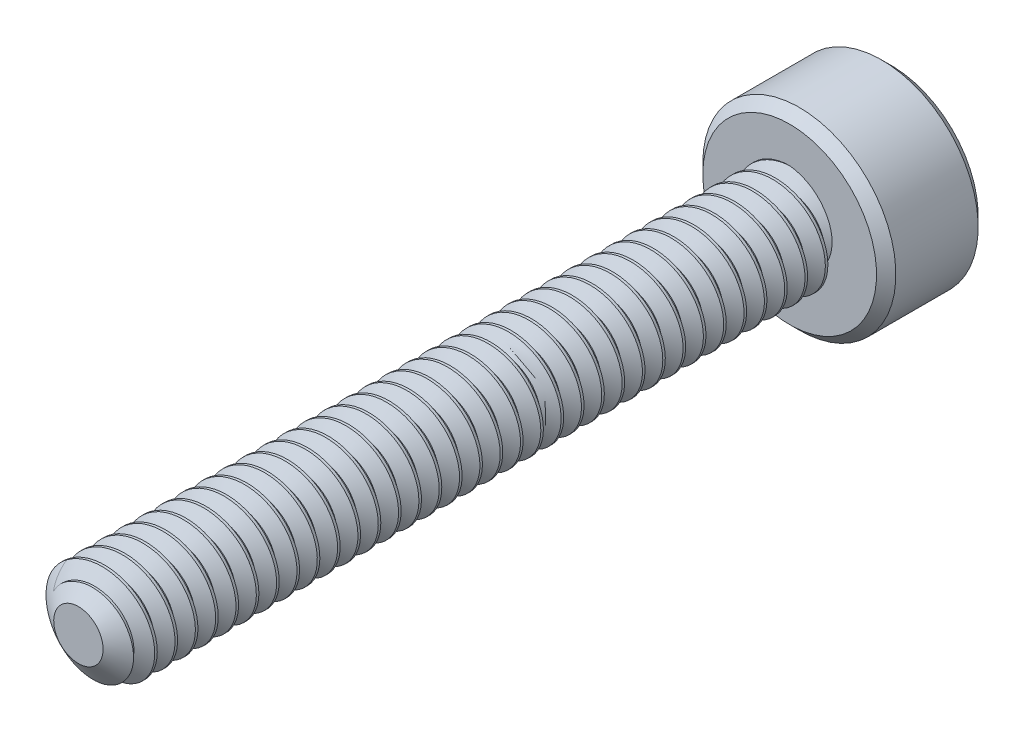
from build123d import *

# Parameters (mm, degrees)
SKETCH1_R          = 1
EXTRUDE1_DEPTH     = 14
CUT_SWEEP1_PITCH   = 0.4
SKETCH6_R          = 1.9
EXTRUDE2_DEPTH     = 2
CUT_EXTRUDE1_DEPTH = 1.125
CHAMFER1_SIZE      = 0.19


with BuildPart() as part:
    # Sketch1 → Extrude1 (new body)
    with BuildSketch(Plane.XY):
        Circle(SKETCH1_R)
    extrude(amount=-EXTRUDE1_DEPTH)

    # Cut-Sweep1: arcs per turn and ends read off the stored shape
    # Cut-Sweep1: the profile of Sketch3 profile screwed along a right-hand helix through 38 turns, 6 arcs to a turn; built about Z, then put on its axis
    cut_sweep1_z = Axis((0, 0, 0), (0, 0, 1))
    cut_sweep1_corners = [(1.0003, 0, -0.750173205), (0.740192379, 0, -0.6), (0.740192379, 0, -0.55), (1.0003, 0, -0.399826795)]
    with BuildLine(mode=Mode.PRIVATE) as cut_sweep1_profile:
        Line(cut_sweep1_corners[0], cut_sweep1_corners[1])
        Line(cut_sweep1_corners[1], cut_sweep1_corners[2])
        Line(cut_sweep1_corners[2], cut_sweep1_corners[3])
        Line(cut_sweep1_corners[3], cut_sweep1_corners[0])
    cut_sweep1_cap = Face(cut_sweep1_profile.wire())
    cut_sweep1_turn_angles = [0, 30, 60, 90, 120, 150, 180, 210, 240, 270, 300, 330, 360]
    cut_sweep1_turn_weights = [1, 0.8660254037844387, 1, 0.8660254037844387, 1, 0.8660254037844387, 1, 0.8660254037844387, 1, 0.8660254037844387, 1, 0.8660254037844387, 1]
    cut_sweep1_turn_rails = [Edge.make_bspline([Vector(p[0], p[1], 0).rotate(cut_sweep1_z, cut_sweep1_turn_angles[k]) / cut_sweep1_turn_weights[k] + Vector(0, 0, p[2] + CUT_SWEEP1_PITCH * cut_sweep1_turn_angles[k] / 360) for k in range(13)], [0, 0, 0, 1, 1, 2, 2, 3, 3, 4, 4, 5, 5, 6, 6, 6], 2, cut_sweep1_turn_weights) for p in cut_sweep1_corners]
    cut_sweep1_turn_sides = [Face.make_surface_from_curves(cut_sweep1_turn_rails[p[0]], cut_sweep1_turn_rails[p[1]]) for p in [(0, 1), (1, 2), (2, 3), (3, 0)]]
    cut_sweep1 = Plane(origin=(0, 0, 0), x_dir=(0, 1, 0), z_dir=(0, 0, -1)) * Solid(Shell([*[p.moved(Location((0, 0, CUT_SWEEP1_PITCH * i))) for i in range(38) for p in cut_sweep1_turn_sides], cut_sweep1_cap, cut_sweep1_cap.rotate(cut_sweep1_z, 13680).moved(Location((0, 0, CUT_SWEEP1_PITCH * 13680 / 360)))]))
    add(cut_sweep1, mode=Mode.SUBTRACT)

    # Sketch4 → Cut-Revolve1 (revolve, cut)
    with BuildSketch(Plane(origin=(0, 0, 0), x_dir=(0, 0, -1), z_dir=(1, 0, 0)), mode=Mode.PRIVATE) as cut_revolve1_sk:
        Polygon((0.35977197, 1), (0, 0.486192379), (0, 1), align=None)
    revolve(cut_revolve1_sk.sketch.rotate(Axis((0, 0, 0), (0, 0, -1)), 270), axis=Axis((0, 0, 0), (0, 0, -1)), mode=Mode.SUBTRACT)

    # Sketch6 → Extrude2 (add)
    with BuildSketch(Plane(origin=(0, 0, -14), x_dir=(-1, 0, 0), z_dir=(0, 0, -1))):
        Circle(SKETCH6_R)
    extrude(amount=EXTRUDE2_DEPTH)

    # Sketch7 → Cut-Extrude1 (cut)
    with BuildSketch(Plane(origin=(0, 0, -16), x_dir=(-1, 0, 0), z_dir=(0, 0, -1))):
        Polygon((0, 0.866025404), (-0.75, 0.433012702), (-0.75, -0.433012702), (0, -0.866025404), (0.75, -0.433012702), (0.75, 0.433012702), align=None)
    extrude(amount=-CUT_EXTRUDE1_DEPTH, mode=Mode.SUBTRACT)

    # Cut-Extrude2 cone 1 section (through the dimple's axis) → Cut-Extrude2 (revolve, cut)
    with BuildSketch(Plane(origin=(0, 0, -16), x_dir=(0, 1, 0), z_dir=(1, 0, 0))):
        Polygon((0, 0), (0.866025404, 0), (0, 0.866025404), align=None)
    revolve(axis=Axis((0, 0, -16), (0, 0, 1)), mode=Mode.SUBTRACT)

    # Chamfer1
    chamfer1_edges = [part.edges().sort_by_distance(p)[0] for p in [
        (1.9, 0, -14),
        (1.9, 0, -16),
    ]]
    chamfer(chamfer1_edges, length=CHAMFER1_SIZE)


solid = part.part
